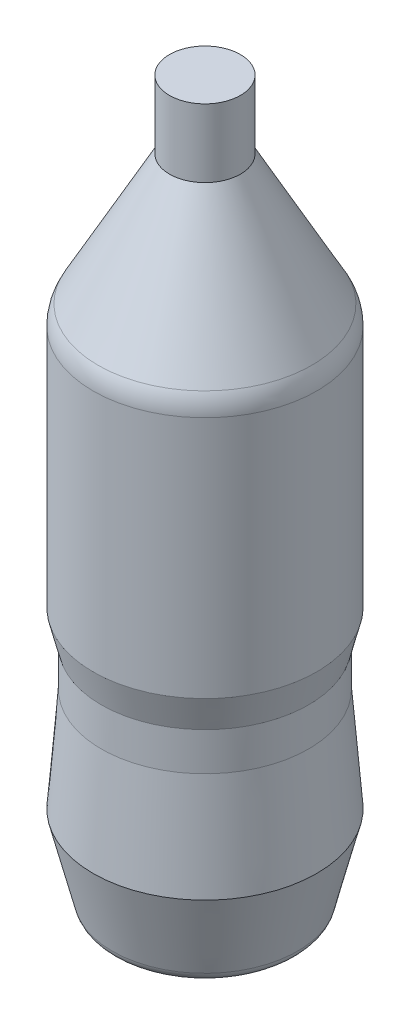
from build123d import *

# Parameters (mm, degrees)
SKETCH1_R           = 41
BOSS_EXTRUDE1_DEPTH = 265
SKETCH2_OUTSIDE_W   = 141.852
SKETCH2_OUTSIDE_H   = 141.852
SKETCH2_OUTSIDE_R   = 13
CUT_EXTRUDE1_DEPTH  = 25
CHAMFER1_SIZE2      = 28
CHAMFER1_SIZE       = 51
CUT_EXTRUDE2_START  = -32
SKETCH3_OUTSIDE_W   = 141.852
SKETCH3_OUTSIDE_H   = 141.852
SKETCH3_OUTSIDE_R   = 38
CUT_EXTRUDE2_DEPTH  = 64
CHAMFER2_SIZE2      = 38
CHAMFER2_SIZE       = 3
CHAMFER3_SIZE2      = 3
CHAMFER3_SIZE       = 12
CHAMFER4_SIZE2      = 8
CHAMFER4_SIZE       = 32
FILLET1_R           = 5
FILLET2_R           = 15


with BuildPart() as part:
    # Sketch1 → Boss-Extrude1 (new body)
    with BuildSketch(Plane(origin=(0, 0, 0), x_dir=(1, 0, 0), z_dir=(0, 1, 0))):
        with Locations(Location((0, 0, 0), (0, 0, 270))):
            Circle(SKETCH1_R)
    extrude(amount=BOSS_EXTRUDE1_DEPTH)

    # Sketch2 outside → Cut-Extrude1 (cut)
    with BuildSketch(Plane(origin=(0, 265, 0), x_dir=(1, 0, 0), z_dir=(0, 1, 0))):
        Rectangle(SKETCH2_OUTSIDE_W, SKETCH2_OUTSIDE_H)
        with Locations(Location((0, 0, 0), (0, 0, 270))):
            Circle(SKETCH2_OUTSIDE_R, mode=Mode.SUBTRACT)
    extrude(amount=-CUT_EXTRUDE1_DEPTH, mode=Mode.SUBTRACT)

    # Chamfer1
    chamfer1_edges = [part.edges().sort_by_distance(p)[0] for p in [
        (0, 240, -41),
    ]]
    chamfer1_side = [part.faces().sort_by_distance(p)[0] for p in [
        (0, 239.44, -41),
    ]]
    chamfer(chamfer1_edges, length=CHAMFER1_SIZE - 0.0001, length2=CHAMFER1_SIZE2 - 0.0001, reference=chamfer1_side[0])  # a hair under: the kernel refuses the full size

    # Sketch3 outside → Cut-Extrude2 (cut)
    with BuildSketch(Plane.XZ.offset(CUT_EXTRUDE2_START)):
        Rectangle(SKETCH3_OUTSIDE_W, SKETCH3_OUTSIDE_H)
        with Locations(Location((0, 0, 0), (0, 0, 270))):
            Circle(SKETCH3_OUTSIDE_R, mode=Mode.SUBTRACT)
    extrude(amount=-CUT_EXTRUDE2_DEPTH, mode=Mode.SUBTRACT)

    # Chamfer2
    chamfer2_edges = [part.edges().sort_by_distance(p)[0] for p in [
        (0, 32, 38),
    ]]
    chamfer2_side = [part.faces().sort_by_distance(p)[0] for p in [
        (0, 32, 38.06),
    ]]
    chamfer(chamfer2_edges, length=CHAMFER2_SIZE - 0.0001, length2=CHAMFER2_SIZE2 - 0.0001, reference=chamfer2_side[0])  # a hair under: the kernel refuses the full size

    # Chamfer3
    chamfer3_edges = [part.edges().sort_by_distance(p)[0] for p in [
        (0, 96, 38),
    ]]
    chamfer3_side = [part.faces().sort_by_distance(p)[0] for p in [
        (0, 95.94, 38),
    ]]
    chamfer(chamfer3_edges, length=CHAMFER3_SIZE - 0.0001, length2=CHAMFER3_SIZE2 - 0.0001, reference=chamfer3_side[0])  # a hair under: the kernel refuses the full size

    # Chamfer4
    chamfer4_edges = [part.edges().sort_by_distance(p)[0] for p in [
        (0, 0, -41),
    ]]
    chamfer4_side = [part.faces().sort_by_distance(p)[0] for p in [
        (0, 0.16, -41),
    ]]
    chamfer(chamfer4_edges, length=CHAMFER4_SIZE - 0.0001, length2=CHAMFER4_SIZE2 - 0.0001, reference=chamfer4_side[0])  # a hair under: the kernel refuses the full size

    # Fillet1
    fillet1_edges = [part.edges().sort_by_distance(p)[0] for p in [
        (0, 0, -33.0001),
    ]]
    fillet(fillet1_edges, radius=FILLET1_R)

    # Fillet2
    fillet2_edges = [part.edges().sort_by_distance(p)[0] for p in [
        (0, 189.0001, -41),
    ]]
    fillet(fillet2_edges, radius=FILLET2_R)


solid = part.part
